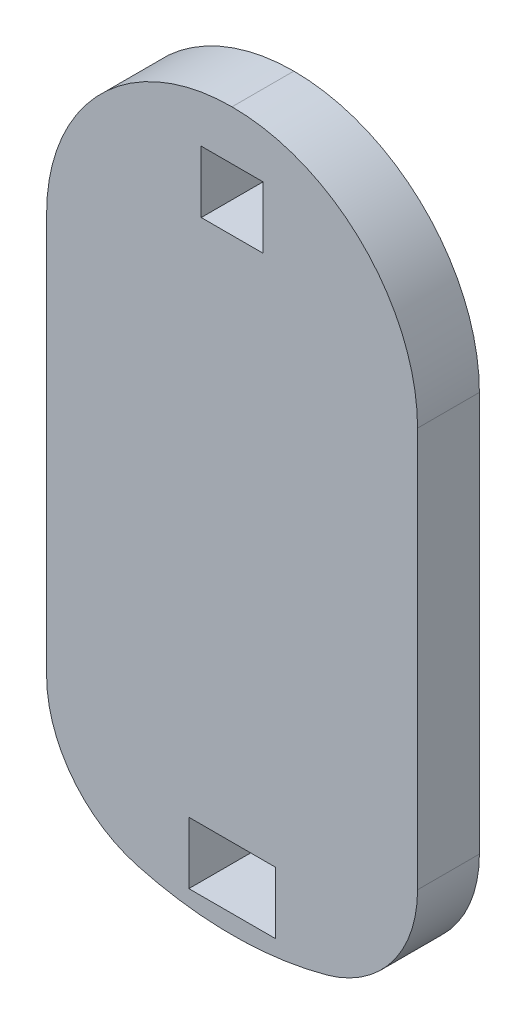
from build123d import *

# Parameters (mm, degrees)
SKETCH1_R           = 29
BOSS_EXTRUDE1_DEPTH = 5
CUT_EXTRUDE3_START  = -10
CUT_EXTRUDE3_DEPTH  = 10
FILLET2_R           = 15
FILLET3_R           = 10
SKETCH7_W           = 5
SKETCH7_H           = 5
SKETCH7_W_2         = 7
CUT_EXTRUDE4_DEPTH  = 10


with BuildPart() as part:
    # Sketch1 → Boss-Extrude1 (new body)
    with BuildSketch(Plane.XY):
        Circle(SKETCH1_R)
    extrude(amount=BOSS_EXTRUDE1_DEPTH)

    # Sketch6 → Cut-Extrude3 (cut)
    with BuildSketch(Plane.XY.offset(5).offset(CUT_EXTRUDE3_START)):
        with BuildLine():
            Line((-15.004747761, 24.816477281), (-15.004747761, -24.816477281))
            ThreePointArc((-15.004747761, -24.816477281), (-29, 0), (-15.004747761, 24.816477281))
        make_face()
        with BuildLine():
            Line((14.995252239, 24.822216063), (14.995252239, -24.822216063))
            ThreePointArc((14.995252239, -24.822216063), (29, 0), (14.995252239, 24.822216063))
        make_face()
    extrude(amount=CUT_EXTRUDE3_DEPTH, mode=Mode.SUBTRACT)

    # Fillet2
    fillet2_edges = [part.edges().sort_by_distance(p)[0] for p in [
        (-15.004747761, 24.816477281, 2.5),
        (14.995252239, 24.822216063, 2.5),
    ]]
    fillet(fillet2_edges, radius=FILLET2_R - 0.0001)  # a hair under: the kernel refuses the full size

    # Fillet3
    fillet3_edges = [part.edges().sort_by_distance(p)[0] for p in [
        (-15.004747761, -24.816477281, 2.5),
        (14.995252239, -24.822216063, 2.5),
    ]]
    fillet(fillet3_edges, radius=FILLET3_R)

    # Sketch7 → Cut-Extrude4 (cut)
    with BuildSketch(Plane.XY.offset(5)):
        with Locations((0, 22.499998332)):
            Rectangle(SKETCH7_W, SKETCH7_H)
        with Locations((0, -25.000001668)):
            Rectangle(SKETCH7_W_2, SKETCH7_H)
    extrude(amount=-CUT_EXTRUDE4_DEPTH, mode=Mode.SUBTRACT)


solid = part.part
